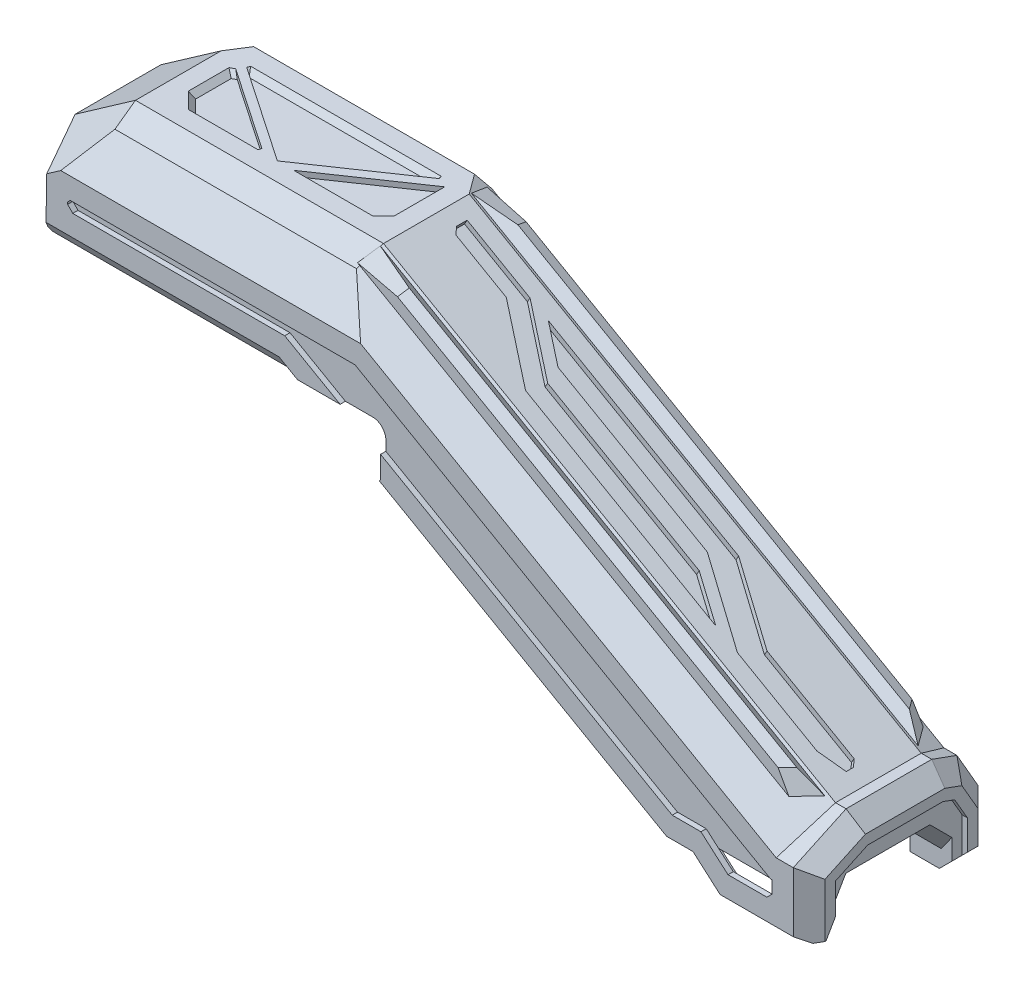
from build123d import *
from OCP.BRepFilletAPI import BRepFilletAPI_MakeChamfer

# Parameters (mm, degrees)
BOSS_EXTRU_1_DEPTH            = 350
CHANFREIN2_SIZE               = 250
CHANFREIN2_SIZE_2             = 175.051884552
CHANFREIN1_SIZE               = 50
CHANFREIN1_SIZE2              = 35.900752153
ENL_V_MAT_EXTRU_7_DEPTH       = 1046.526183316
CHANFREIN3_SIZE               = 38
CHANFREIN3_SIZE2              = 50.080014711
CHANFREIN4_SIZE               = 20
CHANFREIN4_SIZE2              = 11.547005384
BOSS_EXTRU_2_START            = -350
BOSS_EXTRU_2_DEPTH            = 350
ENL_V_MAT_EXTRU_8_DEPTH       = 1195.954331861
ENL_V_MAT_EXTRU_9_DEPTH       = 1195.954331861
ESQUISSE13_W                  = 310
ESQUISSE13_H                  = 114.380191108
ENL_V_MAT_EXTRU_10_DEPTH      = 880
CHANFREIN5_SIZE2              = 50
CHANFREIN5_SIZE               = 86.602540378
CHANFREIN6_SIZE               = 37.587704832
CHANFREIN6_SIZE_2             = 20
CHANFREIN6_SIZE_3             = 28.559592457
CHANFREIN7_SIZE               = 100
CHANFREIN7_SIZE2              = 46.630765816
CHANFREIN8_SIZE               = 60
CHANFREIN8_SIZE_2             = 103.923048454
CHANFREIN9_SIZE               = 60
CHANFREIN9_SIZE2              = 39.448637967
CHANFREIN10_SIZE              = 30
ENL_V_MAT_EXTRU_11_DEPTH      = 10
CHANFREIN12_SIZE              = 30
CHANFREIN13_SIZE              = 10
CHANFREIN13_SIZE2             = 8.164965809
CHANFREIN14_SIZE              = 50
CHANFREIN15_SIZE              = 60
CHANFREIN15_SIZE_2            = 34.641016151
BOSS_EXTRU_4_REACH            = 1326.463
CHANFREIN16_SIZE              = 38.516854936
CHANFREIN16_SIZE_2            = 70
CHANFREIN16_SIZE_3            = 37.721202703
CHANFREIN19_SIZE              = 20
CHANFREIN19_SIZE_2            = 74.641016151
ENL_V_MAT_EXTRU_12_DEPTH      = 10
ENL_V_MAT_EXTRU_13_DEPTH      = 10
CHANFREIN20_SIZE              = 10
ENL_V_MAT_EXTRU_15_DEPTH      = 10
CHANFREIN25_SIZE              = 20
ENL_V_MAT_EXTRU_16_DEPTH      = 10
COQUE1_START                  = 10
COQUE1_DEPTH                  = 10
COQUE1_START_2                = 330
COQUE1_2_DEPTH                = 10
ENL_V_MAT_EXTRU_6_DEPTH       = 100
ENL_V_MAT_EXTRU_17_DEPTH      = 1195.954331861
ENL_V_MAT_EXTRU_17_DEPTH_BACK = 1195.954331861
ESQUISSE25_W                  = 1654.380238498
ESQUISSE25_H                  = 406.499530843


# Read off the part's stored shape, not the designer's step: Coque1
# Some blends are built 0.0001 mm under size
with BuildPart() as part:
    # Esquisse1 → Boss.-Extru.1 (new body)
    with BuildSketch(Plane.XY):
        Polygon((770, 0), (800, 64.335207615), (800, 115.619808892), (-3.915334439, 575), (-700, 575), (-700, 400), (0, 400), (700, 0), (700, -70), align=None)
    extrude(amount=BOSS_EXTRU_1_DEPTH)

    # Chanfrein2
    # the kernel refuses this chamfer: 250, 175.051884552 mm, written as the material it takes off along each edge
    with BuildSketch(Plane(origin=(-700, 575, -645.638057571), x_dir=(0.9997533347641299, 0.022209674198457152, 0), z_dir=(0, 0, 1))) as chanfrein2_piece_1:
        Polygon((CHANFREIN2_SIZE * 0.999753334764, -CHANFREIN2_SIZE * 0.0222096741985), (-CHANFREIN2_SIZE_2 * 0.0222096741985, -CHANFREIN2_SIZE_2 * 0.999753334767), (0, 0), align=None)
    extrude(amount=1641.276115142, mode=Mode.SUBTRACT)

    # Chanfrein1: one chamfer whose edges measure the first distance from different faces: ONE call of the kernel's chamfer builder (chamfer() names one face for all edges)
    chanfrein1_edges_1 = [part.edges().sort_by_distance(p)[0] for p in [
        (-226.957667219, 575, 0),
        (398.042332781, 345.309904446, 0),
        (800, 89.977508254, 0),
        (785, 32.167603808, 0),
        (-226.957667219, 575, 350),
        (785, 32.167603808, 350),
        (800, 89.977508254, 350),
        (398.042332781, 345.309904446, 350),
    ]]
    chanfrein1_edges_2 = [part.edges().sort_by_distance(p)[0] for p in [
        (-699.92590118, 400, 175),
    ]]
    chanfrein1_side_2 = [part.faces().sort_by_distance(p)[0] for p in [
        (-574.96295059, 487.5, 175),
    ]]
    chanfrein1 = BRepFilletAPI_MakeChamfer(part.part.solid().wrapped)
    for e in chanfrein1_edges_1:
        chanfrein1.Add(CHANFREIN1_SIZE, e.wrapped)
    for e in chanfrein1_edges_2:
        chanfrein1.Add(CHANFREIN1_SIZE, CHANFREIN1_SIZE2, e.wrapped, chanfrein1_side_2[0].wrapped)  # the first distance lies on this face
    add(Compound.cast(chanfrein1.Shape()), mode=Mode.REPLACE)

    # Esquisse8 → Enlèv. mat.-Extru.7 (cut, through all)
    with BuildSketch(Plane(origin=(0, 0, 0), x_dir=(-1, 0, 0), z_dir=(0, 0, -1))):
        Polygon((664.025149027, 400), (664.025149027, 545), (584.025149027, 545), (450.59661924, 367.095293618), (664.025149027, 367.095293618), align=None)
    extrude(amount=-ENL_V_MAT_EXTRU_7_DEPTH, mode=Mode.SUBTRACT)

    # Chanfrein3
    chanfrein3_edges = [part.edges().sort_by_distance(p)[0] for p in [
        (-552.628966854, 503.13842377, 175),
    ]]
    chanfrein3_side = [part.faces().sort_by_distance(p)[0] for p in [
        (-504.350921839, 536.943074819, 175),
    ]]
    chamfer(chanfrein3_edges, length=CHANFREIN3_SIZE, length2=CHANFREIN3_SIZE2, reference=chanfrein3_side[0])

    # Chanfrein4: one chamfer whose edges measure the first distance from different faces: ONE call of the kernel's chamfer builder (chamfer() names one face for all edges)
    chanfrein4_edges_1 = [part.edges().sort_by_distance(p)[0] for p in [
        (-237.637574513, 400, 0),
    ]]
    chanfrein4_side_1 = [part.faces().sort_by_distance(p)[0] for p in [
        (-487.815553743, 439.871580839, 0),
    ]]
    chanfrein4_edges_2 = [part.edges().sort_by_distance(p)[0] for p in [
        (-237.637574513, 400, 350),
    ]]
    chanfrein4_side_2 = [part.faces().sort_by_distance(p)[0] for p in [
        (-237.637574513, 400, 175),
    ]]
    chanfrein4 = BRepFilletAPI_MakeChamfer(part.part.solid().wrapped)
    for e in chanfrein4_edges_1:
        chanfrein4.Add(CHANFREIN4_SIZE, CHANFREIN4_SIZE2, e.wrapped, chanfrein4_side_1[0].wrapped)  # the first distance lies on this face
    for e in chanfrein4_edges_2:
        chanfrein4.Add(CHANFREIN4_SIZE, CHANFREIN4_SIZE2, e.wrapped, chanfrein4_side_2[0].wrapped)  # the first distance lies on this face
    add(Compound.cast(chanfrein4.Shape()), mode=Mode.REPLACE)

    # Esquisse11 → Boss.-Extru.2 (add)
    with BuildSketch(Plane.XY.offset(350).offset(BOSS_EXTRU_2_START)):
        Polygon((969.221778146, 115.619808892), (969.221778146, -104.380191108), (869.221778146, -104.380191108), (749.221778146, 0.444698202), (699.221778146, 0.444698202), (699.221778146, 40.949971099), (699.221778146, 115.619808892), (-17.193556293, 525), (-521.407400337, 525), (-450, 575), (-407.155559798, 605), (62.806443707, 605), (919.221778146, 115.619808892), align=None)
    extrude(amount=BOSS_EXTRU_2_DEPTH)

    # Esquisse10 → Enlèv. mat.-Extru.8 (cut, through all)
    with BuildSketch(Plane(origin=(0, 0, 0), x_dir=(0, 0, -1), z_dir=(1, 0, 0))):
        Polygon((-238.5, -340), (-18, -340), (32, -290), (32, -163.205080757), (-68, 10), (-230.5, 10), (-280.5, -40), (-280.5, -267.253866082), align=None)
    extrude(amount=ENL_V_MAT_EXTRU_8_DEPTH, mode=Mode.SUBTRACT)

    # Esquisse12 → Enlèv. mat.-Extru.9 (cut, through all)
    with BuildSketch(Plane.XY):
        Polygon((760.549484854, -9.450515146), (700, -70), (700, 0), (699.221778146, 0.444698202), (700, 0.444698202), (715.038470229, 0.444698202), (749.221778146, 0.444698202), align=None)
    extrude(amount=ENL_V_MAT_EXTRU_9_DEPTH, mode=Mode.SUBTRACT)

    # Esquisse13 → Enlèv. mat.-Extru.10 (cut)
    with BuildSketch(Plane(origin=(0, 0, 0), x_dir=(0, 0, -1), z_dir=(1, 0, 0))):
        with Locations((-175, -47.190095554)):
            Rectangle(ESQUISSE13_W, ESQUISSE13_H)
    extrude(amount=ENL_V_MAT_EXTRU_10_DEPTH, mode=Mode.SUBTRACT)

    # Chanfrein5
    chanfrein5_edges = [part.edges().sort_by_distance(p)[0] for p in [
        (-503.258180546, 437.310708692, 350),
    ]]
    chanfrein5_side = [part.faces().sort_by_distance(p)[0] for p in [
        (-502.458180546, 437.910708692, 350),
    ]]
    chamfer(chanfrein5_edges, length=CHANFREIN5_SIZE, length2=CHANFREIN5_SIZE2, reference=chanfrein5_side[0])
    chanfrein5_2_edges = [part.edges().sort_by_distance(p)[0] for p in [
        (919.221778146, -104.380191108, 350),
    ]]
    chanfrein5_2_side = [part.faces().sort_by_distance(p)[0] for p in [
        (919.221778146, -103.380191108, 350),
    ]]
    chamfer(chanfrein5_2_edges, length=CHANFREIN5_SIZE, length2=CHANFREIN5_SIZE2, reference=chanfrein5_2_side[0])
    chanfrein5_3_edges = [part.edges().sort_by_distance(p)[0] for p in [
        (-444.403041222, 578.919032728, 350),
    ]]
    chanfrein5_3_side = [part.faces().sort_by_distance(p)[0] for p in [
        (-443.829464785, 578.099880683, 350),
    ]]
    chamfer(chanfrein5_3_edges, length=CHANFREIN5_SIZE, length2=CHANFREIN5_SIZE2, reference=chanfrein5_3_side[0])
    chanfrein5_4_edges = [part.edges().sort_by_distance(p)[0] for p in [
        (-96.681097287, 605, 350),
    ]]
    chanfrein5_4_side = [part.faces().sort_by_distance(p)[0] for p in [
        (-96.681097287, 604, 350),
    ]]
    chamfer(chanfrein5_4_edges, length=CHANFREIN5_SIZE, length2=CHANFREIN5_SIZE2, reference=chanfrein5_4_side[0])
    chanfrein5_5_edges = [part.edges().sort_by_distance(p)[0] for p in [
        (566.791333758, 317.008634257, 350),
    ]]
    chanfrein5_5_side = [part.faces().sort_by_distance(p)[0] for p in [
        (566.29519482, 316.140391115, 350),
    ]]
    chamfer(chanfrein5_5_edges, length=CHANFREIN5_SIZE, length2=CHANFREIN5_SIZE2, reference=chanfrein5_5_side[0])
    chanfrein5_6_edges = [part.edges().sort_by_distance(p)[0] for p in [
        (944.221778146, 115.619808892, 350),
    ]]
    chanfrein5_6_side = [part.faces().sort_by_distance(p)[0] for p in [
        (944.221778146, 114.619808892, 350),
    ]]
    chamfer(chanfrein5_6_edges, length=CHANFREIN5_SIZE, length2=CHANFREIN5_SIZE2, reference=chanfrein5_6_side[0])

    # Chanfrein6
    chanfrein6_edges_1 = [part.edges().sort_by_distance(p)[0] for p in [
        (-498.928053527, 431.537206001, 300),
    ]]
    chanfrein6_side_1 = [part.faces().sort_by_distance(p)[0] for p in [
        (-498.928053527, 431.537206001, 299.6),
    ]]
    chanfrein6_edges_2 = [part.edges().sort_by_distance(p)[0] for p in [
        (-464.328374484, 564.967164176, 300),
    ]]
    chanfrein6_side_2 = [part.faces().sort_by_distance(p)[0] for p in [
        (-464.328374484, 564.967164176, 299.6),
    ]]
    chanfrein6_edges_3 = [part.edges().sort_by_distance(p)[0] for p in [
        (944.221778146, 115.619808892, 300),
    ]]
    chanfrein6_side_3 = [part.faces().sort_by_distance(p)[0] for p in [
        (944.221778146, 115.619808892, 299.6),
    ]]
    chanfrein6_edges_4 = [part.edges().sort_by_distance(p)[0] for p in [
        (491.014110927, 360.309904446, 300),
    ]]
    chanfrein6_side_4 = [part.faces().sort_by_distance(p)[0] for p in [
        (491.014110927, 360.309904446, 299.6),
    ]]
    chanfrein6 = BRepFilletAPI_MakeChamfer(part.part.solid().wrapped)
    for e in chanfrein6_edges_1:
        chanfrein6.Add(CHANFREIN6_SIZE, CHANFREIN6_SIZE_2, e.wrapped, chanfrein6_side_1[0].wrapped)
    for e in chanfrein6_edges_2:
        chanfrein6.Add(CHANFREIN6_SIZE, CHANFREIN6_SIZE_2, e.wrapped, chanfrein6_side_2[0].wrapped)
    for e in chanfrein6_edges_3:
        chanfrein6.Add(CHANFREIN6_SIZE, CHANFREIN6_SIZE_2, e.wrapped, chanfrein6_side_3[0].wrapped)
    for e in chanfrein6_edges_4:
        chanfrein6.Add(CHANFREIN6_SIZE, CHANFREIN6_SIZE_2, e.wrapped, chanfrein6_side_4[0].wrapped)
    add(Compound.cast(chanfrein6.Shape()), mode=Mode.REPLACE)
    chanfrein6_2_edges = [part.edges().sort_by_distance(p)[0] for p in [
        (-522.027781761, 494.765859107, 311.233740484),
    ]]
    chanfrein6_2_side = [part.faces().sort_by_distance(p)[0] for p in [
        (-522.025449715, 494.899461915, 310.856719461),
    ]]
    chamfer(chanfrein6_2_edges, length=CHANFREIN6_SIZE_3, length2=CHANFREIN6_SIZE_2, reference=chanfrein6_2_side[0])

    # Chanfrein7: one chamfer whose edges measure the first distance from different faces: ONE call of the kernel's chamfer builder (chamfer() names one face for all edges)
    chanfrein7_edges_1 = [part.edges().sort_by_distance(p)[0] for p in [
        (-522.041073599, 494.004370176, 0),
    ]]
    chanfrein7_side_1 = [part.faces().sort_by_distance(p)[0] for p in [
        (-522.037946591, 494.183516362, 138.904295522),
    ]]
    chanfrein7_edges_2 = [part.edges().sort_by_distance(p)[0] for p in [
        (-464.328374484, 564.967164176, 0),
    ]]
    chanfrein7_side_2 = [part.faces().sort_by_distance(p)[0] for p in [
        (-464.328374484, 564.967164176, 131.206147584),
    ]]
    chanfrein7_edges_3 = [part.edges().sort_by_distance(p)[0] for p in [
        (944.221778146, 115.619808892, 0),
    ]]
    chanfrein7_side_3 = [part.faces().sort_by_distance(p)[0] for p in [
        (944.221778146, 115.619808892, 131.206147584),
    ]]
    chanfrein7_edges_4 = [part.edges().sort_by_distance(p)[0] for p in [
        (491.014110927, 360.309904446, 0),
    ]]
    chanfrein7_side_4 = [part.faces().sort_by_distance(p)[0] for p in [
        (491.014110927, 360.309904446, 131.206147584),
    ]]
    chanfrein7_edges_5 = [part.edges().sort_by_distance(p)[0] for p in [
        (-172.174558045, 605, 0),
    ]]
    chanfrein7_side_5 = [part.faces().sort_by_distance(p)[0] for p in [
        (-172.28340669, 605, 149.051112193),
    ]]
    chanfrein7 = BRepFilletAPI_MakeChamfer(part.part.solid().wrapped)
    for e in chanfrein7_edges_1:
        chanfrein7.Add(CHANFREIN7_SIZE, CHANFREIN7_SIZE2, e.wrapped, chanfrein7_side_1[0].wrapped)  # the first distance lies on this face
    for e in chanfrein7_edges_2:
        chanfrein7.Add(CHANFREIN7_SIZE, CHANFREIN7_SIZE2, e.wrapped, chanfrein7_side_2[0].wrapped)  # the first distance lies on this face
    for e in chanfrein7_edges_3:
        chanfrein7.Add(CHANFREIN7_SIZE, CHANFREIN7_SIZE2, e.wrapped, chanfrein7_side_3[0].wrapped)  # the first distance lies on this face
    for e in chanfrein7_edges_4:
        chanfrein7.Add(CHANFREIN7_SIZE, CHANFREIN7_SIZE2, e.wrapped, chanfrein7_side_4[0].wrapped)  # the first distance lies on this face
    for e in chanfrein7_edges_5:
        chanfrein7.Add(CHANFREIN7_SIZE, CHANFREIN7_SIZE2, e.wrapped, chanfrein7_side_5[0].wrapped)  # the first distance lies on this face
    add(Compound.cast(chanfrein7.Shape()), mode=Mode.REPLACE)

    # Chanfrein8
    # the kernel refuses this chamfer: 103.923048454, 60 mm, written as the material it takes off along each edge
    with BuildSketch(Plane(origin=(1238.079616381, -104.380191108, 0), x_dir=(0, 0.9983227437537926, -0.05789386240267138), z_dir=(-1, 0, 0))) as chanfrein8_piece_1:
        Polygon((CHANFREIN8_SIZE * 0.998322743754, -CHANFREIN8_SIZE * 0.0578938624027), (-CHANFREIN8_SIZE_2 * 0.0578938624027, -CHANFREIN8_SIZE_2 * 0.998322743755), (0, 0), align=None)
    extrude(amount=637.71567647, mode=Mode.SUBTRACT)

    # Chanfrein9
    chanfrein9_edges = [part.edges().sort_by_distance(p)[0] for p in [
        (-171.014982589, 558.369234184, 0),
    ]]
    chanfrein9_side = [part.faces().sort_by_distance(p)[0] for p in [
        (-171.600504883, 581.915224928, 50.4945401),
    ]]
    chamfer(chanfrein9_edges, length=CHANFREIN9_SIZE, length2=CHANFREIN9_SIZE2, reference=chanfrein9_side[0])

    # Chanfrein10
    chanfrein10_edges = [part.edges().sort_by_distance(p)[0] for p in [
        (969.221778146, 5.619808892, 350),
        (969.221778146, 63.658284665, 330),
        (969.221778146, 115.619808892, 181.206147584),
        (969.221778146, 92.304425984, 50),
        (969.221778146, 12.304425984, 0),
        (969.221778146, 106.959554854, 286.206147584),
    ]]
    chamfer(chanfrein10_edges, length=CHANFREIN10_SIZE)

    # Esquisse14 → Enlèv. mat.-Extru.11 (cut)
    with BuildSketch(Plane(origin=(969.221778146, 0, 0), x_dir=(0, 0, -1), z_dir=(1, 0, 0))):
        Polygon((-50, 18.823085464), (-50, -128.717758405), (-300, -125.514481834), (-300, -31.215728753), (-300, 15.619808892), (-275.797985667, 57.538927362), (-253.595946133, 65.619808892), (-111.084733132, 65.619808892), (-50, 37.135530036), align=None)
    extrude(amount=-ENL_V_MAT_EXTRU_11_DEPTH, mode=Mode.SUBTRACT)

    # Chanfrein12
    # the kernel refuses this chamfer: 30 mm, written as the material it takes off along each edge
    with BuildSketch(Plane(origin=(802.849510361, -104.380191108, 280.5), x_dir=(0, -0.027495876610586334, 0.9996219169112968), z_dir=(1, 0, 0))) as chanfrein12_piece_1:
        Polygon((CHANFREIN12_SIZE * 0.999621916911, -CHANFREIN12_SIZE * 0.0274958766106), (-CHANFREIN12_SIZE * 0.0274958766106, -CHANFREIN12_SIZE * 0.999621916911), (0, 0), align=None)
    extrude(amount=233.522757424, mode=Mode.SUBTRACT)

    # Chanfrein13: one chamfer whose edges measure the first distance from different faces: ONE call of the kernel's chamfer builder (chamfer() names one face for all edges)
    chanfrein13_edges_1 = [part.edges().sort_by_distance(p)[0] for p in [
        (924.610889073, -97.723457848, 303.84326674),
    ]]
    chanfrein13_side_1 = [part.faces().sort_by_distance(p)[0] for p in [
        (920.519132037, -86.250326886, 292.370135778),
    ]]
    chanfrein13_edges_2 = [part.edges().sort_by_distance(p)[0] for p in [
        (923.337232333, -60.23000706, 27.452686519),
    ]]
    chanfrein13 = BRepFilletAPI_MakeChamfer(part.part.solid().wrapped)
    for e in chanfrein13_edges_1:
        chanfrein13.Add(CHANFREIN13_SIZE, CHANFREIN13_SIZE2, e.wrapped, chanfrein13_side_1[0].wrapped)  # the first distance lies on this face
    for e in chanfrein13_edges_2:
        chanfrein13.Add(CHANFREIN13_SIZE, e.wrapped)
    add(Compound.cast(chanfrein13.Shape()), mode=Mode.REPLACE)

    # Chanfrein14
    # the kernel refuses this chamfer: 50 mm, written as the material it takes off along each edge
    with BuildSketch(Plane(origin=(969.221778146, -90.652390036, 171.415850602), x_dir=(0.027495876610586594, 0.9996219169112966, 3.973721413055188e-13), z_dir=(0, 0, 1))) as chanfrein14_piece_1:
        Polygon((CHANFREIN14_SIZE * 0.999621916911, CHANFREIN14_SIZE * 0.0274958766106), (-CHANFREIN14_SIZE * 0.0274958766106, CHANFREIN14_SIZE * 0.999621916911), (0, 0), align=None)
    extrude(amount=265.094048441, mode=Mode.SUBTRACT)

    # Chanfrein15
    # the kernel refuses this chamfer: 60, 34.641016151 mm, written as the material it takes off along each edge
    with BuildSketch(Plane(origin=(833.99494602, -76.568540583, 350), x_dir=(-0.009588760972956507, -0.01678033170267389, -0.9998132206222079), z_dir=(-0.8682431421244593, 0.4961389383568337, 0))) as chanfrein15_piece_1_section:
        Polygon((CHANFREIN15_SIZE * 0.999813220622, -CHANFREIN15_SIZE * 0.0193267656127), (-CHANFREIN15_SIZE_2 * 0.0193267656129, -CHANFREIN15_SIZE_2 * 0.999813220633), (0, 0), align=None)
    chanfrein15_piece_1 = extrude(amount=1139.053480912, mode=Mode.PRIVATE)
    chanfrein15_piece_1 = split(chanfrein15_piece_1, bisect_by=Plane(origin=(434.093023121, 400, 329.914599538), z_dir=(0, -1, 0)), keep=Keep.TOP, mode=Mode.PRIVATE)
    chanfrein15_piece_1 = split(chanfrein15_piece_1, bisect_by=Plane(origin=(434.093023121, 341.12100737, 228.018593267), z_dir=(0, -0.8660254037844377, 0.5000000000000018)), keep=Keep.TOP, mode=Mode.PRIVATE)
    add(chanfrein15_piece_1, mode=Mode.SUBTRACT)
    with BuildSketch(Plane(origin=(833.99494602, -76.568540583, 350), x_dir=(-0.009588760972956507, -0.01678033170267389, -0.9998132206222079), z_dir=(-0.8682431421244593, 0.4961389383568337, 0))) as chanfrein15_piece_2_section:
        Polygon((CHANFREIN15_SIZE * 0.999813220622, -CHANFREIN15_SIZE * 0.0193267656127), (-CHANFREIN15_SIZE_2 * 0.0193267656129, -CHANFREIN15_SIZE_2 * 0.999813220633), (0, 0), align=None)
    chanfrein15_piece_2 = extrude(amount=1139.053480912, mode=Mode.PRIVATE)
    chanfrein15_piece_2 = split(chanfrein15_piece_2, bisect_by=Plane(origin=(24.661938096, 400, 344.83966552), z_dir=(0, 1, 0)), keep=Keep.TOP, mode=Mode.PRIVATE)
    chanfrein15_piece_2 = split(chanfrein15_piece_2, bisect_by=Plane(origin=(24.661938096, 407.496724272, 342.98470733), z_dir=(0, -0.8660254037844377, 0.5000000000000018)), keep=Keep.TOP, mode=Mode.PRIVATE)
    add(chanfrein15_piece_2, mode=Mode.SUBTRACT)
    with BuildSketch(Plane(origin=(833.99494602, -76.568540583, 350), x_dir=(-0.009588760972956507, -0.01678033170267389, -0.9998132206222079), z_dir=(-0.8682431421244593, 0.4961389383568337, 0))) as chanfrein15_piece_3_section:
        Polygon((CHANFREIN15_SIZE * 0.999813220622, -CHANFREIN15_SIZE * 0.0193267656127), (-CHANFREIN15_SIZE_2 * 0.0193267656129, -CHANFREIN15_SIZE_2 * 0.999813220633), (0, 0), align=None)
    chanfrein15_piece_3 = extrude(amount=1139.053480912, mode=Mode.PRIVATE)
    chanfrein15_piece_3 = split(chanfrein15_piece_3, bisect_by=Plane(origin=(20.037530227, 400, 308.079266552), z_dir=(0, -1, 0)), keep=Keep.TOP, mode=Mode.PRIVATE)
    chanfrein15_piece_3 = split(chanfrein15_piece_3, bisect_by=Plane(origin=(20.037530227, 388.926051313, 310.819358233), z_dir=(0, 0.8660254037844377, -0.5000000000000018)), keep=Keep.TOP, mode=Mode.PRIVATE)
    add(chanfrein15_piece_3, mode=Mode.SUBTRACT)

    # Boss.-Extru.4: up to this plane
    boss_extru_4_end = Plane(origin=(969.221778146, 115.619808892, -1650.816647385), z_dir=(0, 1, 0))
    # Esquisse17 → Boss.-Extru.4 (add, up to the surface)
    with BuildSketch(Plane(origin=(-213.26898859, 121.86799348, 0), x_dir=(0, 0, 1), z_dir=(-0.8682431421244594, 0.4961389383568337, 0)), mode=Mode.PRIVATE) as boss_extru_4_sk1:
        Polygon((303.7335822, 541.408104767), (267.412295169, 554.627972117), (283.016415343, 570.232092291), (301.810267758, 563.391689425), align=None)
    boss_extru_4_tool1 = split(extrude(boss_extru_4_sk1.sketch, amount=-BOSS_EXTRU_4_REACH, mode=Mode.PRIVATE), bisect_by=boss_extru_4_end, keep=Keep.BOTH, mode=Mode.PRIVATE)
    add(boss_extru_4_tool1.solids().sort_by_distance((62.792066, 604.974839, 288.630582))[0])
    # Esquisse17 → Boss.-Extru.4 (add, up to the surface)
    with BuildSketch(Plane(origin=(-213.26898859, 121.86799348, 0), x_dir=(0, 0, 1), z_dir=(-0.8682431421244594, 0.4961389383568337, 0)), mode=Mode.PRIVATE) as boss_extru_4_sk2:
        Polygon((59.96911379, 559.848672865), (59.96911379, 537.781114486), (95, 554.116284998), (78.09526953, 568.3010381), align=None)
    boss_extru_4_tool2 = split(extrude(boss_extru_4_sk2.sketch, amount=-BOSS_EXTRU_4_REACH, mode=Mode.PRIVATE), bisect_by=boss_extru_4_end, keep=Keep.BOTH, mode=Mode.PRIVATE)
    add(boss_extru_4_tool2.solids().sort_by_distance((61.617309, 602.919015, 73.706371))[0])

    # Chanfrein16
    # the kernel refuses this chamfer: 70, 38.516854936, 37.721202703 mm, written as the material it takes off along each edge
    with BuildSketch(Plane(origin=(826.098154283, 115.619808892, 447.828037928), x_dir=(-0.804435793096865, -0.06796776471265657, -0.5901384903093365), z_dir=(0.5915063382511557, 0, -0.8063003483868214))) as chanfrein16_piece_1_section:
        Polygon((CHANFREIN16_SIZE * 0.997687517688, CHANFREIN16_SIZE * 0.0679677647123), (CHANFREIN16_SIZE_2 * 0.774694715725, CHANFREIN16_SIZE_2 * 0.632335431102), (0, 0), align=None)
    chanfrein16_piece_1 = extrude(amount=385.500754621, mode=Mode.PRIVATE)
    chanfrein16_piece_1 = split(chanfrein16_piece_1, bisect_by=Plane(origin=(908.63756145, 118.770486454, 269.324090727), z_dir=(0.4662180992592283, 0.8158816737036569, 0.3420201433214599)), keep=Keep.TOP, mode=Mode.PRIVATE)
    add(chanfrein16_piece_1, mode=Mode.SUBTRACT)
    with BuildSketch(Plane(origin=(802.050833, 115.619808892, -71.99079901), x_dir=(-0.7268525664432114, -0.07065776140355189, 0.6831491984979238), z_dir=(0.6848609283151116, 0, 0.7286738014141606))) as chanfrein16_piece_2_section:
        Polygon((CHANFREIN16_SIZE_3 * 0.997500616918, -CHANFREIN16_SIZE_3 * 0.0706577614035), (CHANFREIN16_SIZE_2 * 0.741326834409, -CHANFREIN16_SIZE_2 * 0.671144190607), (0, 0), align=None)
    chanfrein16_piece_2 = extrude(amount=387.067547636, mode=Mode.PRIVATE)
    chanfrein16_piece_2 = split(chanfrein16_piece_2, bisect_by=Plane(origin=(906.545262263, 120.390305197, 95.394966407), z_dir=(0.4496545832848922, 0.7868955207485674, -0.4226182617407002)), keep=Keep.TOP, mode=Mode.PRIVATE)
    add(chanfrein16_piece_2, mode=Mode.SUBTRACT)

    # Chanfrein19
    chanfrein19_edges_1 = [part.edges().sort_by_distance(p)[0] for p in [
        (66.590511363, 611.622118397, 69.03219166),
    ]]
    chanfrein19_side_1 = [part.faces().sort_by_distance(p)[0] for p in [
        (66.41064953, 611.307360189, 69.201238965),
    ]]
    chanfrein19_edges_2 = [part.edges().sort_by_distance(p)[0] for p in [
        (67.948461189, 613.998530592, 292.413341551),
    ]]
    chanfrein19_side_2 = [part.faces().sort_by_distance(p)[0] for p in [
        (67.761973949, 613.672177922, 292.276533493),
    ]]
    chanfrein19 = BRepFilletAPI_MakeChamfer(part.part.solid().wrapped)
    for e in chanfrein19_edges_1:
        chanfrein19.Add(CHANFREIN19_SIZE - 0.0001, CHANFREIN19_SIZE_2 - 0.0001, e.wrapped, chanfrein19_side_1[0].wrapped)
    for e in chanfrein19_edges_2:
        chanfrein19.Add(CHANFREIN19_SIZE - 0.0001, CHANFREIN19_SIZE_2 - 0.0001, e.wrapped, chanfrein19_side_2[0].wrapped)
    add(Compound.cast(chanfrein19.Shape()), mode=Mode.REPLACE)  # a hair under: the kernel refuses the full size

    # Esquisse19 → Enlèv. mat.-Extru.12 (cut)
    with BuildSketch(Plane(origin=(0, 0, 0), x_dir=(-1, 0, 0), z_dir=(0, 0, -1))):
        Polygon((425.990659978, 460), (435.816135914, 469.998476952), (435.747661775, 473.921357741), (430.660399743, 478.920596217), (-108.835509593, 478.920596217), (-896.215727589, 28.989043077), (-899.221778146, 28.989043077), (-899.221778146, 5.619808892), (-889.221778146, -4.380191108), (-815.546331243, -4.380191108), (-764.232308852, 40.444698202), (-709.844355629, 40.444698202), (24.377422517, 460), align=None)
    extrude(amount=-ENL_V_MAT_EXTRU_12_DEPTH, mode=Mode.SUBTRACT)

    # Esquisse20 → Enlèv. mat.-Extru.13 (cut)
    with BuildSketch(Plane(origin=(0, 605, 0), x_dir=(1, 0, 0), z_dir=(0, 1, 0))):
        Polygon((27.806443707, -155), (7.806443707, -135), (-142.356594493, -135), (27.806443707, -250.950900137), align=None)
        Polygon((-355.797630397, -259.368931201), (-354.061471161, -265), (7.499947335, -265), (9.236106571, -259.368931201), (-173.280761913, -135), align=None)
        Polygon((-342.155559798, -135), (-372.155559798, -165), (-372.155559798, -242.24462036), (-363.891719033, -246.61355156), (-208.357771118, -140.631068799), (-210.093930354, -135), align=None)
    extrude(amount=-ENL_V_MAT_EXTRU_13_DEPTH, mode=Mode.SUBTRACT)

    # Chanfrein20
    chanfrein20_edges = [part.edges().sort_by_distance(p)[0] for p in [
        (8.368026953, 595, 262.1844656),
        (-173.280761913, 595, 265),
        (-354.929550779, 595, 262.1844656),
        (-368.023639416, 595, 244.42908596),
        (-372.155559798, 595, 203.62231018),
        (-357.155559798, 595, 150),
        (-276.124745076, 595, 135),
        (27.806443707, 595, 202.975450068),
        (17.806443707, 595, 145),
        (-67.275075393, 595, 135),
    ]]
    chamfer(chanfrein20_edges, length=CHANFREIN20_SIZE - 0.0001)  # a hair under: the kernel refuses the full size

    # Esquisse22 → Enlèv. mat.-Extru.15 (cut)
    with BuildSketch(Plane(origin=(276.075432297, 483.13200652, 0), x_dir=(0.8682431421244593, -0.4961389383568338, 0), z_dir=(0.4961389383568338, 0.8682431421244593, 0))):
        Polygon((-155.632793676, -232.412295169), (-78.3122856, -232.412295169), (36.360125789, -166.206147584), (367.123843681, -166.206147584), (444.768177741, -130), (29.788980649, -130), (-95.632793676, -202.412295169), (-205.632793676, -202.412295169), (-215.632793676, -212.412295169), (-215.632793676, -232.412295169), align=None)
        Polygon((700.74451573, -170), (510.74451573, -170), (376.900916816, -232.412295169), (-38.3122856, -232.412295169), (24.398601562, -196.206147584), (350.112667729, -196.206147584), (492.092209404, -130), (665.74451573, -130), (710.74451573, -146.378660542), (710.74451573, -160), align=None)
    extrude(amount=-ENL_V_MAT_EXTRU_15_DEPTH, mode=Mode.SUBTRACT)

    # Chanfrein25
    chanfrein25_edges = [part.edges().sort_by_distance(p)[0] for p in [
        (959.221778146, 10, 149.25),
        (959.221778146, -15, 255.5),
    ]]
    chamfer(chanfrein25_edges, length=CHANFREIN25_SIZE)

    # Esquisse23 → Enlèv. mat.-Extru.16 (cut)
    with BuildSketch(Plane.XY.offset(350)):
        Polygon((-360.682227592, 441.547005384), (57.580873909, 441.547005384), (808.899022108, 12.222349271), (865.147398825, 12.222349271), (31.84095571, 488.397459622), (-370.390920036, 488.397459622), (-387.064069542, 476.722794652), align=None)
    extrude(amount=-ENL_V_MAT_EXTRU_16_DEPTH, mode=Mode.SUBTRACT)

    # Coque1 outline → Coque1 (cut)
    with BuildSketch(Plane.XY.offset(COQUE1_START)):
        Polygon((772.436414623, 20), (811.793698567, -14.380191108), (890, -14.380191108), (890, 20), align=None)
    extrude(amount=COQUE1_DEPTH, mode=Mode.SUBTRACT)

    # Coque1 2 outline → Coque1 2 (cut)
    with BuildSketch(Plane.XY.offset(COQUE1_START_2)):
        Polygon((871.692154419, 20), (775.13248896, 20), (806.243377737, 2.222349271), (890, 2.222349271), (890, 9.538373954), align=None)
    extrude(amount=COQUE1_2_DEPTH, mode=Mode.SUBTRACT)

    # Esquisse7 → Enlèv. mat.-Extru.6 (cut)
    with BuildSketch(Plane(origin=(0, 0, 0), x_dir=(-1, 0, 0), z_dir=(0, 0, -1))):
        with BuildLine():
            Line((-154.724318643, 310.669872981), (-7.5, 395.669872981))
            Line((-7.5, 395.669872981), (0, 400))
            Line((0, 400), (-10, 400))
            Line((-10, 400), (-132.099318643, 400))
            ThreePointArc((-132.099318643, 400), (-149.865376521, 392.641057877), (-157.224318643, 374.875))
            Line((-157.224318643, 374.875), (-157.224318643, 315))
            Line((-157.224318643, 315), (-154.724318643, 310.669872981))
        make_face()
    extrude(amount=-ENL_V_MAT_EXTRU_6_DEPTH, mode=Mode.SUBTRACT)

    # Symétrie1: part across plane


with BuildPart() as part_1:
    add(part.part)
    add(part.part.mirror(Plane(origin=(0, 0, 0), x_dir=(1, 0, 0), z_dir=(0, 0, -1))))

    # Esquisse25 → Enlèv. mat.-Extru.17 (cut, two sides: drawn at the far end of the back side and taken through both)
    with BuildSketch(Plane(origin=(0, 0, 0), x_dir=(1, 0, 0), z_dir=(0, 1, 0)).offset(-ENL_V_MAT_EXTRU_17_DEPTH_BACK)):
        with Locations((209.824985849, -203.249765422)):
            Rectangle(ESQUISSE25_W, ESQUISSE25_H)
    extrude(amount=ENL_V_MAT_EXTRU_17_DEPTH + ENL_V_MAT_EXTRU_17_DEPTH_BACK, mode=Mode.SUBTRACT)


solid = part_1.part
